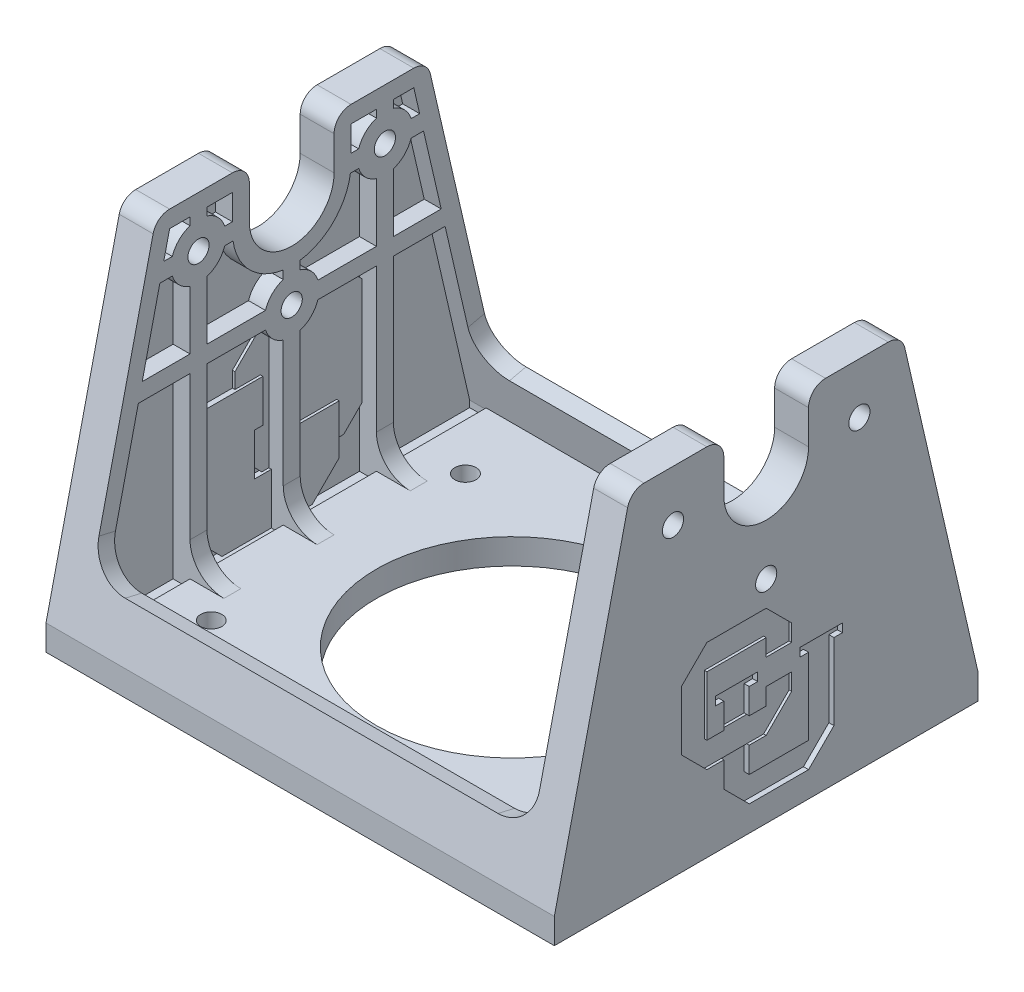
from build123d import *

# Parameters (mm, degrees)
SKETCH2_W           = 52
SKETCH2_H           = 50
BOSS_EXTRUDE2_DEPTH = 3
BOSS_EXTRUDE3_DEPTH = 4
CUT_EXTRUDE1_REACH  = 76.33
SKETCH4_R           = 1.25
SKETCH5_W           = 52
SKETCH5_H           = 6
BOSS_EXTRUDE4_DEPTH = 2
CUT_EXTRUDE2_REACH  = 57.191
SKETCH7_R           = 16
CUT_EXTRUDE3_REACH  = 57.191
SKETCH8_R           = 1.25
FILLET2_R           = 2
CUT_EXTRUDE4_DEPTH  = 0.3
CUT_EXTRUDE5_DEPTH  = 0.6
CIRPATTERN2_COUNT   = 2
SHELL2_START        = -27.7
SHELL2_OUTLINE_R    = 3.25
SHELL2_DEPTH        = 1.7
SHELL2_START_2      = 26
SHELL2_2_OUTLINE_R  = 3.25
SHELL2_2_DEPTH      = 1.7
SHELL2_START_3      = -27.4
SHELL2_3_DEPTH      = 1.4
SHELL2_4_DEPTH      = 1.4
SHELL2_START_4      = -28
SHELL2_5_OUTLINE_R  = 3.25
SHELL2_5_DEPTH      = 0.3
SHELL2_START_5      = 27.7
SHELL2_6_OUTLINE_R  = 3.25
SHELL2_6_DEPTH      = 0.3
BOSS_EXTRUDE7_REACH = 76.33
FILLET3_R           = 4
FILLET4_R           = 4


# Read off the part's stored shape, not the designer's step: Shell2
with BuildPart() as part:
    # Sketch2 → Boss-Extrude2 (new body)
    with BuildSketch(Plane(origin=(0, 0, 0), x_dir=(1, 0, 0), z_dir=(0, 1, 0))):
        Rectangle(SKETCH2_W, SKETCH2_H)
    extrude(amount=BOSS_EXTRUDE2_DEPTH)

    # Sketch3 → Boss-Extrude3 (add)
    with BuildSketch(Plane(origin=(26, 0, 0), x_dir=(0, 0, -1), z_dir=(1, 0, 0))):
        with BuildLine():
            Line((-25, 0), (25, 0))
            Line((25, 0), (25, 3))
            Line((25, 3), (16, 42))
            Line((16, 42), (5, 42))
            Line((5, 42), (5, 36))
            ThreePointArc((5, 36), (0, 31), (-5, 36))
            Line((-5, 36), (-5, 42))
            Line((-5, 42), (-16, 42))
            Line((-16, 42), (-25, 3))
            Line((-25, 3), (-25, 0))
        make_face()
    boss_extrude3 = extrude(amount=BOSS_EXTRUDE3_DEPTH)

    # Sketch4 → Cut-Extrude1 (cut, up to next)
    with BuildSketch(Plane(origin=(30, 0, 0), x_dir=(0, 0, -1), z_dir=(1, 0, 0)), mode=Mode.PRIVATE) as cut_extrude1_sk1:
        with Locations((11, 36)):
            Circle(SKETCH4_R)
    cut_extrude1_tool1 = extrude(cut_extrude1_sk1.sketch, amount=-CUT_EXTRUDE1_REACH, mode=Mode.PRIVATE) & part.part
    # Sketch4 → Cut-Extrude1 (cut, up to next)
    with BuildSketch(Plane(origin=(30, 0, 0), x_dir=(0, 0, -1), z_dir=(1, 0, 0)), mode=Mode.PRIVATE) as cut_extrude1_sk2:
        with Locations((0, 25)):
            Circle(SKETCH4_R)
    cut_extrude1_tool2 = extrude(cut_extrude1_sk2.sketch, amount=-CUT_EXTRUDE1_REACH, mode=Mode.PRIVATE) & part.part
    # Sketch4 → Cut-Extrude1 (cut, up to next)
    with BuildSketch(Plane(origin=(30, 0, 0), x_dir=(0, 0, -1), z_dir=(1, 0, 0)), mode=Mode.PRIVATE) as cut_extrude1_sk3:
        with Locations((-11, 36)):
            Circle(SKETCH4_R)
    cut_extrude1_tool3 = extrude(cut_extrude1_sk3.sketch, amount=-CUT_EXTRUDE1_REACH, mode=Mode.PRIVATE) & part.part
    cut_extrude1_1 = cut_extrude1_tool1.solids().sort_by_distance((30, 36, -11))[0]
    add(cut_extrude1_1, mode=Mode.SUBTRACT)
    cut_extrude1_2 = cut_extrude1_tool2.solids().sort_by_distance((30, 25, 0))[0]
    add(cut_extrude1_2, mode=Mode.SUBTRACT)
    cut_extrude1_3 = cut_extrude1_tool3.solids().sort_by_distance((30, 36, 11))[0]
    add(cut_extrude1_3, mode=Mode.SUBTRACT)
    cut_extrude1 = cut_extrude1_1 + cut_extrude1_2 + cut_extrude1_3  # Cut-Extrude1 as one shape, for the pattern or mirror that repeats it

    # Mirror1: Boss-Extrude3, Cut-Extrude1 across plane
    add(boss_extrude3.mirror(Plane(origin=(0, 0, 0), x_dir=(0, 0, 1), z_dir=(1, 0, 0))))
    add(cut_extrude1.mirror(Plane(origin=(0, 0, 0), x_dir=(0, 0, 1), z_dir=(1, 0, 0))), mode=Mode.SUBTRACT)

    # Sketch5 → Boss-Extrude4 (add)
    with BuildSketch(Plane(origin=(0, 5.629213483, -24.393258427), x_dir=(-1, 0, 0), z_dir=(0, 0.22485950669875854, -0.97439119569462))):
        with Locations((0, 0.30168592)):
            Rectangle(SKETCH5_W, SKETCH5_H)
    boss_extrude4 = extrude(amount=-BOSS_EXTRUDE4_DEPTH)

    # Mirror2: Boss-Extrude4 across plane
    add(boss_extrude4.mirror(Plane.XY))

    # Sketch7 → Cut-Extrude2 (cut, up to next)
    with BuildSketch(Plane(origin=(0, 3, 0), x_dir=(-1, 0, 0), z_dir=(0, 1, 0)), mode=Mode.PRIVATE) as cut_extrude2_sk1:
        with Locations(Location((0, 0, 0), (0, 0, 90))):
            Circle(SKETCH7_R)
    cut_extrude2_tool1 = extrude(cut_extrude2_sk1.sketch, amount=-CUT_EXTRUDE2_REACH, mode=Mode.PRIVATE) & part.part
    add(cut_extrude2_tool1.solids().sort_by_distance((0, 3, 0))[0], mode=Mode.SUBTRACT)

    # Sketch8 → Cut-Extrude3 (cut, up to next)
    with BuildSketch(Plane(origin=(0, 3, 0), x_dir=(1, 0, 0), z_dir=(0, 1, 0)), mode=Mode.PRIVATE) as cut_extrude3_sk1:
        with Locations(Location((20.5, 15.0030003, 0), (0, 0, 270))):
            Circle(SKETCH8_R)
    cut_extrude3_tool1 = extrude(cut_extrude3_sk1.sketch, amount=-CUT_EXTRUDE3_REACH, mode=Mode.PRIVATE) & part.part
    # Sketch8 → Cut-Extrude3 (cut, up to next)
    with BuildSketch(Plane(origin=(0, 3, 0), x_dir=(1, 0, 0), z_dir=(0, 1, 0)), mode=Mode.PRIVATE) as cut_extrude3_sk2:
        with Locations(Location((-20.5, 15.0030003, 0), (0, 0, 270))):
            Circle(SKETCH8_R)
    cut_extrude3_tool2 = extrude(cut_extrude3_sk2.sketch, amount=-CUT_EXTRUDE3_REACH, mode=Mode.PRIVATE) & part.part
    # Sketch8 → Cut-Extrude3 (cut, up to next)
    with BuildSketch(Plane(origin=(0, 3, 0), x_dir=(1, 0, 0), z_dir=(0, 1, 0)), mode=Mode.PRIVATE) as cut_extrude3_sk3:
        with Locations(Location((-20.5, -14.9969997, 0), (0, 0, 270))):
            Circle(SKETCH8_R)
    cut_extrude3_tool3 = extrude(cut_extrude3_sk3.sketch, amount=-CUT_EXTRUDE3_REACH, mode=Mode.PRIVATE) & part.part
    # Sketch8 → Cut-Extrude3 (cut, up to next)
    with BuildSketch(Plane(origin=(0, 3, 0), x_dir=(1, 0, 0), z_dir=(0, 1, 0)), mode=Mode.PRIVATE) as cut_extrude3_sk4:
        with Locations(Location((20.5, -14.9969997, 0), (0, 0, 270))):
            Circle(SKETCH8_R)
    cut_extrude3_tool4 = extrude(cut_extrude3_sk4.sketch, amount=-CUT_EXTRUDE3_REACH, mode=Mode.PRIVATE) & part.part
    add(cut_extrude3_tool1.solids().sort_by_distance((20.5, 3, -15.003))[0], mode=Mode.SUBTRACT)
    add(cut_extrude3_tool2.solids().sort_by_distance((-20.5, 3, -15.003))[0], mode=Mode.SUBTRACT)
    add(cut_extrude3_tool3.solids().sort_by_distance((-20.5, 3, 14.997))[0], mode=Mode.SUBTRACT)
    add(cut_extrude3_tool4.solids().sort_by_distance((20.5, 3, 14.997))[0], mode=Mode.SUBTRACT)

    # Fillet2
    fillet2_edges = [part.edges().sort_by_distance(p)[0] for p in [
        (28, 42, -16),
        (28, 42, -5),
        (28, 42, 5),
        (28, 42, 16),
        (-28, 42, 16),
        (-28, 42, 5),
        (-28, 42, -5),
        (-28, 42, -16),
    ]]
    fillet(fillet2_edges, radius=FILLET2_R)

    # Sketch15 → Cut-Extrude4 (cut)
    with BuildSketch(Plane(origin=(30, 0, 0), x_dir=(0, 0, -1), z_dir=(1, 0, 0))):
        Polygon((-7, 22), (0, 22), (3, 19), (3, 17), (0, 17), (0, 19), (-7, 19), (-7, 12), (0, 12), (0, 14), (3, 14), (3, 12), (0, 9), (-7, 9), (-10, 12), (-10, 19), align=None)
    cut_extrude4 = extrude(amount=-CUT_EXTRUDE4_DEPTH, mode=Mode.SUBTRACT)

    # Sketch16 → Cut-Extrude5 (cut)
    with BuildSketch(Plane(origin=(30, 0, 0), x_dir=(0, 0, -1), z_dir=(1, 0, 0))):
        Polygon((-2, 12), (-2, 15), (-1, 15), (-1, 16), (-6, 16), (-6, 15), (-5, 15), (-5, 12), align=None)
        Polygon((-5, 9), (-5, 6), (-2, 3), (5, 3), (8, 6), (8, 15), (9, 15), (9, 16), (4, 16), (4, 15), (5, 15), (5, 6), (-2, 6), (-2, 9), align=None)
    cut_extrude5 = extrude(amount=-CUT_EXTRUDE5_DEPTH, mode=Mode.SUBTRACT)

    # CirPattern2: Cut-Extrude4, Cut-Extrude5 ×2 about axis
    cirpattern2_axis = Axis((0, 0, 0), (0, 1, 0))
    add([cut_extrude4.rotate(cirpattern2_axis, i * 360 / CIRPATTERN2_COUNT) for i in range(1, CIRPATTERN2_COUNT)], mode=Mode.SUBTRACT)
    add([cut_extrude5.rotate(cirpattern2_axis, i * 360 / CIRPATTERN2_COUNT) for i in range(1, CIRPATTERN2_COUNT)], mode=Mode.SUBTRACT)

    # Shell2 outline → Shell2 (cut)
    with BuildSketch(Plane.YZ.offset(SHELL2_START)):
        with BuildLine():
            Line((11, 0), (11, -7))
            Line((11, -7), (5.171572875, -7))
            Line((5.171572875, -7), (2, -3.828427125))
            Line((2, -3.828427125), (2, -23))
            Line((2, -23), (2.772223957, -23))
            Line((2.772223957, -23), (3, -22.947436298))
            Line((3, -22.947436298), (8.396628161, -21.702060568))
            Line((8.396628161, -21.702060568), (40, -14.408974759))
            Line((40, -14.408974759), (40, -7))
            Line((40, -7), (36, -7))
            ThreePointArc((36, -7), (29, 0), (36, 7))
            Line((36, 7), (40, 7))
            Line((40, 7), (40, 14.408974759))
            Line((40, 14.408974759), (8.396628161, 21.702060568))
            Line((8.396628161, 21.702060568), (3, 22.947436298))
            Line((3, 22.947436298), (2.772223957, 23))
            Line((2.772223957, 23), (2, 23))
            Line((2, 23), (2, 6.828427125))
            Line((2, 6.828427125), (5.171572875, 10))
            Line((5.171572875, 10), (13, 10))
            Line((13, 10), (13, 11))
            Line((13, 11), (18, 11))
            Line((18, 11), (18, 2))
            Line((18, 2), (13, 2))
            Line((13, 2), (13, 3))
            Line((13, 3), (8, 3))
            Line((8, 3), (8, 0))
            Line((8, 0), (11, 0))
        make_face()
        with Locations((25, 0)):
            Circle(SHELL2_OUTLINE_R, mode=Mode.SUBTRACT)
        with Locations((36, -11)):
            Circle(SHELL2_OUTLINE_R, mode=Mode.SUBTRACT)
        with Locations((36, 11)):
            Circle(SHELL2_OUTLINE_R, mode=Mode.SUBTRACT)
    extrude(amount=SHELL2_DEPTH, mode=Mode.SUBTRACT)

    # Shell2 2 outline → Shell2 2 (cut)
    with BuildSketch(Plane.YZ.offset(SHELL2_START_2)):
        with BuildLine():
            Line((8, 0), (8, -3))
            Line((8, -3), (13, -3))
            Line((13, -3), (13, -2))
            Line((13, -2), (18, -2))
            Line((18, -2), (18, -11))
            Line((18, -11), (13, -11))
            Line((13, -11), (13, -10))
            Line((13, -10), (5.171572875, -10))
            Line((5.171572875, -10), (2, -6.828427125))
            Line((2, -6.828427125), (2, -23))
            Line((2, -23), (2.772223957, -23))
            Line((2.772223957, -23), (3, -22.947436298))
            Line((3, -22.947436298), (8.396628161, -21.702060568))
            Line((8.396628161, -21.702060568), (40, -14.408974759))
            Line((40, -14.408974759), (40, -7))
            Line((40, -7), (36, -7))
            ThreePointArc((36, -7), (29, 0), (36, 7))
            Line((36, 7), (40, 7))
            Line((40, 7), (40, 14.408974759))
            Line((40, 14.408974759), (8.396628161, 21.702060568))
            Line((8.396628161, 21.702060568), (3, 22.947436298))
            Line((3, 22.947436298), (2.772223957, 23))
            Line((2.772223957, 23), (2, 23))
            Line((2, 23), (2, 3.828427125))
            Line((2, 3.828427125), (5.171572875, 7))
            Line((5.171572875, 7), (11, 7))
            Line((11, 7), (11, 0))
            Line((11, 0), (8, 0))
        make_face()
        with Locations((25, 0)):
            Circle(SHELL2_2_OUTLINE_R, mode=Mode.SUBTRACT)
        with Locations((36, -11)):
            Circle(SHELL2_2_OUTLINE_R, mode=Mode.SUBTRACT)
        with Locations((36, 11)):
            Circle(SHELL2_2_OUTLINE_R, mode=Mode.SUBTRACT)
    extrude(amount=SHELL2_2_DEPTH, mode=Mode.SUBTRACT)

    # Shell2 3 outline → Shell2 3 (cut)
    with BuildSketch(Plane.YZ.offset(SHELL2_START_3)):
        Polygon((11, -7), (11, 0), (8, 0), (8, 3), (13, 3), (13, 2), (18, 2), (18, 11), (13, 11), (13, 10), (5.171572875, 10), (2, 6.828427125), (2, -3.828427125), (5.171572875, -7), align=None)
    extrude(amount=SHELL2_3_DEPTH, mode=Mode.SUBTRACT)

    # Shell2 4 outline → Shell2 4 (cut)
    with BuildSketch(Plane.YZ.offset(SHELL2_START_2)):
        Polygon((8, -3), (8, 0), (11, 0), (11, 7), (5.171572875, 7), (2, 3.828427125), (2, -6.828427125), (5.171572875, -10), (13, -10), (13, -11), (18, -11), (18, -2), (13, -2), (13, -3), align=None)
    extrude(amount=SHELL2_4_DEPTH, mode=Mode.SUBTRACT)

    # Shell2 5 outline → Shell2 5 (cut)
    # profile 1 of 2: a face of its own
    with BuildSketch(Plane.YZ.offset(SHELL2_START_4)):
        with BuildLine():
            Line((7, -7.828427125), (7, -7))
            Line((7, -7), (5.171572875, -7))
            Line((5.171572875, -7), (2, -3.828427125))
            Line((2, -3.828427125), (2, -23))
            Line((2, -23), (2.772223957, -23))
            Line((2.772223957, -23), (3, -22.947436298))
            Line((3, -22.947436298), (8.396628161, -21.702060568))
            Line((8.396628161, -21.702060568), (40, -14.408974759))
            Line((40, -14.408974759), (40, -7))
            Line((40, -7), (36, -7))
            ThreePointArc((36, -7), (29, 0), (36, 7))
            Line((36, 7), (40, 7))
            Line((40, 7), (40, 14.408974759))
            Line((40, 14.408974759), (8.396628161, 21.702060568))
            Line((8.396628161, 21.702060568), (3, 22.947436298))
            Line((3, 22.947436298), (2.772223957, 23))
            Line((2.772223957, 23), (2, 23))
            Line((2, 23), (2, 6.828427125))
            Line((2, 6.828427125), (5.171572875, 10))
            Line((5.171572875, 10), (13, 10))
            Line((13, 10), (13, 11))
            Line((13, 11), (18, 11))
            Line((18, 11), (18, 5))
            Line((18, 5), (19.828427125, 5))
            Line((19.828427125, 5), (22.617718257, 2.210708868))
            ThreePointArc((22.617718257, 2.210708868), (28.144918232, 0.819749544), (24, -3.092329219))
            Line((24, -3.092329219), (24, -7.828427125))
            Line((24, -7.828427125), (19.828427125, -12))
            Line((19.828427125, -12), (11.171572875, -12))
            Line((11.171572875, -12), (7, -7.828427125))
        make_face()
        with Locations((36, -11)):
            Circle(SHELL2_5_OUTLINE_R, mode=Mode.SUBTRACT)
        with Locations((36, 11)):
            Circle(SHELL2_5_OUTLINE_R, mode=Mode.SUBTRACT)
    # profile 2 of 2: a face of its own
    with BuildSketch(Plane.YZ.offset(SHELL2_START_4)):
        Polygon((8, 3), (8, 1.828427125), (9.171572875, 3), align=None)
    extrude(amount=SHELL2_5_DEPTH, mode=Mode.SUBTRACT)

    # Shell2 6 outline → Shell2 6 (cut)
    # profile 1 of 2: a face of its own
    with BuildSketch(Plane.YZ.offset(SHELL2_START_5)):
        Polygon((8, -3), (9.171572875, -3), (8, -1.828427125), align=None)
    # profile 2 of 2: a face of its own
    with BuildSketch(Plane.YZ.offset(SHELL2_START_5)):
        with BuildLine():
            Line((19.828427125, -5), (18, -5))
            Line((18, -5), (18, -11))
            Line((18, -11), (13, -11))
            Line((13, -11), (13, -10))
            Line((13, -10), (5.171572875, -10))
            Line((5.171572875, -10), (2, -6.828427125))
            Line((2, -6.828427125), (2, -23))
            Line((2, -23), (2.772223957, -23))
            Line((2.772223957, -23), (3, -22.947436298))
            Line((3, -22.947436298), (8.396628161, -21.702060568))
            Line((8.396628161, -21.702060568), (40, -14.408974759))
            Line((40, -14.408974759), (40, -7))
            Line((40, -7), (36, -7))
            ThreePointArc((36, -7), (29, 0), (36, 7))
            Line((36, 7), (40, 7))
            Line((40, 7), (40, 14.408974759))
            Line((40, 14.408974759), (8.396628161, 21.702060568))
            Line((8.396628161, 21.702060568), (3, 22.947436298))
            Line((3, 22.947436298), (2.772223957, 23))
            Line((2.772223957, 23), (2, 23))
            Line((2, 23), (2, 3.828427125))
            Line((2, 3.828427125), (5.171572875, 7))
            Line((5.171572875, 7), (7, 7))
            Line((7, 7), (7, 7.828427125))
            Line((7, 7.828427125), (11.171572875, 12))
            Line((11.171572875, 12), (19.828427125, 12))
            Line((19.828427125, 12), (24, 7.828427125))
            Line((24, 7.828427125), (24, 3.092329219))
            ThreePointArc((24, 3.092329219), (28.144918232, -0.819749544), (22.617718257, -2.210708868))
            Line((22.617718257, -2.210708868), (19.828427125, -5))
        make_face()
        with Locations((36, -11)):
            Circle(SHELL2_6_OUTLINE_R, mode=Mode.SUBTRACT)
        with Locations((36, 11)):
            Circle(SHELL2_6_OUTLINE_R, mode=Mode.SUBTRACT)
    extrude(amount=SHELL2_6_DEPTH, mode=Mode.SUBTRACT)

    # Sketch12 → Boss-Extrude7 (add, up to next)
    with BuildSketch(Plane.ZY.offset(-26), mode=Mode.PRIVATE) as boss_extrude7_sk1:
        with BuildLine():
            Line((-1, 0), (1, 0))
            Line((1, 0), (1, 21.907670781))
            ThreePointArc((1, 21.907670781), (0, 21.75), (-1, 21.907670781))
            Line((-1, 21.907670781), (-1, 0))
        make_face()
    boss_extrude7_tool1 = extrude(boss_extrude7_sk1.sketch, amount=-BOSS_EXTRUDE7_REACH, mode=Mode.PRIVATE) - part.part
    # Sketch12 → Boss-Extrude7 (add, up to next)
    with BuildSketch(Plane.ZY.offset(-26), mode=Mode.PRIVATE) as boss_extrude7_sk2:
        with BuildLine():
            Line((1, 28.092329219), (1, 31.101020514))
            ThreePointArc((1, 31.101020514), (0, 31), (-1, 31.101020514))
            Line((-1, 31.101020514), (-1, 28.092329219))
            ThreePointArc((-1, 28.092329219), (0, 28.25), (1, 28.092329219))
        make_face()
    boss_extrude7_tool2 = extrude(boss_extrude7_sk2.sketch, amount=-BOSS_EXTRUDE7_REACH, mode=Mode.PRIVATE) - part.part
    # Sketch12 → Boss-Extrude7 (add, up to next)
    with BuildSketch(Plane.ZY.offset(-26), mode=Mode.PRIVATE) as boss_extrude7_sk3:
        with BuildLine():
            Line((-12, 0), (-10, 0))
            Line((-10, 0), (-10, 23.987088745))
            Line((-10, 23.987088745), (-3.088124154, 23.987088745))
            ThreePointArc((-3.088124154, 23.987088745), (-3.249971672, 24.986430417), (-3.096474739, 25.987088745))
            Line((-3.096474739, 25.987088745), (-10, 25.987088745))
            Line((-10, 25.987088745), (-10, 32.907670781))
            ThreePointArc((-10, 32.907670781), (-11, 32.75), (-12, 32.907670781))
            Line((-12, 32.907670781), (-12, 25.987088745))
            Line((-12, 25.987088745), (-17.642723511, 25.987088745))
            Line((-17.642723511, 25.987088745), (-18.104261972, 23.987088745))
            Line((-18.104261972, 23.987088745), (-12, 23.987088745))
            Line((-12, 23.987088745), (-12, 0))
        make_face()
    boss_extrude7_tool3 = extrude(boss_extrude7_sk3.sketch, amount=-BOSS_EXTRUDE7_REACH, mode=Mode.PRIVATE) - part.part
    # Sketch12 → Boss-Extrude7 (add, up to next)
    with BuildSketch(Plane.ZY.offset(-26), mode=Mode.PRIVATE) as boss_extrude7_sk4:
        with BuildLine():
            Line((-12, 40), (-10, 40))
            Line((-10, 40), (-10, 39.092329219))
            ThreePointArc((-10, 39.092329219), (-11, 39.25), (-12, 39.092329219))
            Line((-12, 39.092329219), (-12, 40))
        make_face()
    boss_extrude7_tool4 = extrude(boss_extrude7_sk4.sketch, amount=-BOSS_EXTRUDE7_REACH, mode=Mode.PRIVATE) - part.part
    # Sketch12 → Boss-Extrude7 (add, up to next)
    with BuildSketch(Plane.ZY.offset(-26), mode=Mode.PRIVATE) as boss_extrude7_sk5:
        with BuildLine():
            Line((10, 39.092329219), (10, 40))
            Line((10, 40), (12, 40))
            Line((12, 40), (12, 39.092329219))
            ThreePointArc((12, 39.092329219), (11, 39.25), (10, 39.092329219))
        make_face()
    boss_extrude7_tool5 = extrude(boss_extrude7_sk5.sketch, amount=-BOSS_EXTRUDE7_REACH, mode=Mode.PRIVATE) - part.part
    # Sketch12 → Boss-Extrude7 (add, up to next)
    with BuildSketch(Plane.ZY.offset(-26), mode=Mode.PRIVATE) as boss_extrude7_sk6:
        with BuildLine():
            Line((10, 0), (10, 23.987088745))
            Line((10, 23.987088745), (3.088124154, 23.987088745))
            ThreePointArc((3.088124154, 23.987088745), (3.249971672, 24.986430417), (3.096474739, 25.987088745))
            Line((3.096474739, 25.987088745), (10, 25.987088745))
            Line((10, 25.987088745), (10, 32.907670781))
            ThreePointArc((10, 32.907670781), (11, 32.75), (12, 32.907670781))
            Line((12, 32.907670781), (12, 25.987088745))
            Line((12, 25.987088745), (17.642723511, 25.987088745))
            Line((17.642723511, 25.987088745), (18.104261972, 23.987088745))
            Line((18.104261972, 23.987088745), (12, 23.987088745))
            Line((12, 23.987088745), (12, 0))
            Line((12, 0), (10, 0))
        make_face()
    boss_extrude7_tool6 = extrude(boss_extrude7_sk6.sketch, amount=-BOSS_EXTRUDE7_REACH, mode=Mode.PRIVATE) - part.part
    # Sketch12 → Boss-Extrude7 (add, up to next)
    with BuildSketch(Plane.ZY.offset(-26), mode=Mode.PRIVATE) as boss_extrude7_sk7:
        with BuildLine():
            Line((-15.101282452, 37), (-14.092329219, 37))
            ThreePointArc((-14.092329219, 37), (-14.25, 36), (-14.092329219, 35))
            Line((-14.092329219, 35), (-15.562820913, 35))
            Line((-15.562820913, 35), (-15.101282452, 37))
        make_face()
    boss_extrude7_tool7 = extrude(boss_extrude7_sk7.sketch, amount=-BOSS_EXTRUDE7_REACH, mode=Mode.PRIVATE) - part.part
    # Sketch12 → Boss-Extrude7 (add, up to next)
    with BuildSketch(Plane.ZY.offset(-26), mode=Mode.PRIVATE) as boss_extrude7_sk8:
        with BuildLine():
            Line((-7.907670781, 37), (-7, 37))
            Line((-7, 37), (-7, 36))
            ThreePointArc((-7, 36), (-6.982027736, 35.498712962), (-6.92820323, 35))
            Line((-6.92820323, 35), (-7.907670781, 35))
            ThreePointArc((-7.907670781, 35), (-7.75, 36), (-7.907670781, 37))
        make_face()
    boss_extrude7_tool8 = extrude(boss_extrude7_sk8.sketch, amount=-BOSS_EXTRUDE7_REACH, mode=Mode.PRIVATE) - part.part
    # Sketch12 → Boss-Extrude7 (add, up to next)
    with BuildSketch(Plane.ZY.offset(-26), mode=Mode.PRIVATE) as boss_extrude7_sk9:
        with BuildLine():
            Line((7, 37), (7, 36))
            ThreePointArc((7, 36), (6.982027736, 35.498712962), (6.92820323, 35))
            Line((6.92820323, 35), (7.907670781, 35))
            ThreePointArc((7.907670781, 35), (7.75, 36), (7.907670781, 37))
            Line((7.907670781, 37), (7, 37))
        make_face()
    boss_extrude7_tool9 = extrude(boss_extrude7_sk9.sketch, amount=-BOSS_EXTRUDE7_REACH, mode=Mode.PRIVATE) - part.part
    # Sketch12 → Boss-Extrude7 (add, up to next)
    with BuildSketch(Plane.ZY.offset(-26), mode=Mode.PRIVATE) as boss_extrude7_sk10:
        with BuildLine():
            Line((15.101282452, 37), (15.562820913, 35))
            Line((15.562820913, 35), (14.092329219, 35))
            ThreePointArc((14.092329219, 35), (14.25, 36), (14.092329219, 37))
            Line((14.092329219, 37), (15.101282452, 37))
        make_face()
    boss_extrude7_tool10 = extrude(boss_extrude7_sk10.sketch, amount=-BOSS_EXTRUDE7_REACH, mode=Mode.PRIVATE) - part.part
    boss_extrude7_1 = boss_extrude7_tool1.solids().sort_by_distance((26, 10.901068, 0))[0]
    add(boss_extrude7_1)
    boss_extrude7_2 = boss_extrude7_tool2.solids().sort_by_distance((26, 29.615523, 0))[0]
    add(boss_extrude7_2)
    boss_extrude7_3 = boss_extrude7_tool3.solids().sort_by_distance((26, 18.792438, -10.850347))[0]
    add(boss_extrude7_3)
    boss_extrude7_4 = boss_extrude7_tool4.solids().sort_by_distance((26, 39.597614, -11))[0]
    add(boss_extrude7_4)
    boss_extrude7_5 = boss_extrude7_tool5.solids().sort_by_distance((26, 39.597614, 11))[0]
    add(boss_extrude7_5)
    boss_extrude7_6 = boss_extrude7_tool6.solids().sort_by_distance((26, 18.792438, 10.850347))[0]
    add(boss_extrude7_6)
    boss_extrude7_7 = boss_extrude7_tool7.solids().sort_by_distance((26, 35.932172, -14.771867))[0]
    add(boss_extrude7_7)
    boss_extrude7_8 = boss_extrude7_tool8.solids().sort_by_distance((26, 35.988993, -7.396167))[0]
    add(boss_extrude7_8)
    boss_extrude7_9 = boss_extrude7_tool9.solids().sort_by_distance((26, 35.988993, 7.396167))[0]
    add(boss_extrude7_9)
    boss_extrude7_10 = boss_extrude7_tool10.solids().sort_by_distance((26, 35.932172, 14.771867))[0]
    add(boss_extrude7_10)
    boss_extrude7 = boss_extrude7_1 + boss_extrude7_2 + boss_extrude7_3 + boss_extrude7_4 + boss_extrude7_5 + boss_extrude7_6 + boss_extrude7_7 + boss_extrude7_8 + boss_extrude7_9 + boss_extrude7_10  # Boss-Extrude7 as one shape, for the pattern or mirror that repeats it

    # Mirror3: Boss-Extrude7 mirrored; each copy of Boss-Extrude7 runs up to whatever stops it at its own place
    mirror3_before = part.part  # the part as the pattern finds it: every copy runs up to it
    mirror3_boss_extrude7_long1 = extrude(boss_extrude7_sk1.sketch, amount=-BOSS_EXTRUDE7_REACH, mode=Mode.PRIVATE)
    mirror3_boss_extrude7_long2 = extrude(boss_extrude7_sk2.sketch, amount=-BOSS_EXTRUDE7_REACH, mode=Mode.PRIVATE)
    mirror3_boss_extrude7_long3 = extrude(boss_extrude7_sk3.sketch, amount=-BOSS_EXTRUDE7_REACH, mode=Mode.PRIVATE)
    mirror3_boss_extrude7_long4 = extrude(boss_extrude7_sk4.sketch, amount=-BOSS_EXTRUDE7_REACH, mode=Mode.PRIVATE)
    mirror3_boss_extrude7_long5 = extrude(boss_extrude7_sk5.sketch, amount=-BOSS_EXTRUDE7_REACH, mode=Mode.PRIVATE)
    mirror3_boss_extrude7_long6 = extrude(boss_extrude7_sk6.sketch, amount=-BOSS_EXTRUDE7_REACH, mode=Mode.PRIVATE)
    mirror3_boss_extrude7_long7 = extrude(boss_extrude7_sk7.sketch, amount=-BOSS_EXTRUDE7_REACH, mode=Mode.PRIVATE)
    mirror3_boss_extrude7_long8 = extrude(boss_extrude7_sk8.sketch, amount=-BOSS_EXTRUDE7_REACH, mode=Mode.PRIVATE)
    mirror3_boss_extrude7_long9 = extrude(boss_extrude7_sk9.sketch, amount=-BOSS_EXTRUDE7_REACH, mode=Mode.PRIVATE)
    mirror3_boss_extrude7_long10 = extrude(boss_extrude7_sk10.sketch, amount=-BOSS_EXTRUDE7_REACH, mode=Mode.PRIVATE)
    mirror3_boss_extrude7_tool1_1 = mirror3_boss_extrude7_long1.mirror(Plane(origin=(0, 0, 0), x_dir=(0, 0, 1), z_dir=(1, 0, 0))) - mirror3_before
    add(mirror3_boss_extrude7_tool1_1.solids().sort_by_distance((-26, 10.901068, 0))[0])
    mirror3_boss_extrude7_tool2_1 = mirror3_boss_extrude7_long2.mirror(Plane(origin=(0, 0, 0), x_dir=(0, 0, 1), z_dir=(1, 0, 0))) - mirror3_before
    add(mirror3_boss_extrude7_tool2_1.solids().sort_by_distance((-26, 29.615523, 0))[0])
    mirror3_boss_extrude7_tool3_1 = mirror3_boss_extrude7_long3.mirror(Plane(origin=(0, 0, 0), x_dir=(0, 0, 1), z_dir=(1, 0, 0))) - mirror3_before
    add(mirror3_boss_extrude7_tool3_1.solids().sort_by_distance((-26, 18.792438, -10.850347))[0])
    mirror3_boss_extrude7_tool4_1 = mirror3_boss_extrude7_long4.mirror(Plane(origin=(0, 0, 0), x_dir=(0, 0, 1), z_dir=(1, 0, 0))) - mirror3_before
    add(mirror3_boss_extrude7_tool4_1.solids().sort_by_distance((-26, 39.597614, -11))[0])
    mirror3_boss_extrude7_tool5_1 = mirror3_boss_extrude7_long5.mirror(Plane(origin=(0, 0, 0), x_dir=(0, 0, 1), z_dir=(1, 0, 0))) - mirror3_before
    add(mirror3_boss_extrude7_tool5_1.solids().sort_by_distance((-26, 39.597614, 11))[0])
    mirror3_boss_extrude7_tool6_1 = mirror3_boss_extrude7_long6.mirror(Plane(origin=(0, 0, 0), x_dir=(0, 0, 1), z_dir=(1, 0, 0))) - mirror3_before
    add(mirror3_boss_extrude7_tool6_1.solids().sort_by_distance((-26, 18.792438, 10.850347))[0])
    mirror3_boss_extrude7_tool7_1 = mirror3_boss_extrude7_long7.mirror(Plane(origin=(0, 0, 0), x_dir=(0, 0, 1), z_dir=(1, 0, 0))) - mirror3_before
    add(mirror3_boss_extrude7_tool7_1.solids().sort_by_distance((-26, 35.932172, -14.771867))[0])
    mirror3_boss_extrude7_tool8_1 = mirror3_boss_extrude7_long8.mirror(Plane(origin=(0, 0, 0), x_dir=(0, 0, 1), z_dir=(1, 0, 0))) - mirror3_before
    add(mirror3_boss_extrude7_tool8_1.solids().sort_by_distance((-26, 35.988993, -7.396167))[0])
    mirror3_boss_extrude7_tool9_1 = mirror3_boss_extrude7_long9.mirror(Plane(origin=(0, 0, 0), x_dir=(0, 0, 1), z_dir=(1, 0, 0))) - mirror3_before
    add(mirror3_boss_extrude7_tool9_1.solids().sort_by_distance((-26, 35.988993, 7.396167))[0])
    mirror3_boss_extrude7_tool10_1 = mirror3_boss_extrude7_long10.mirror(Plane(origin=(0, 0, 0), x_dir=(0, 0, 1), z_dir=(1, 0, 0))) - mirror3_before
    add(mirror3_boss_extrude7_tool10_1.solids().sort_by_distance((-26, 35.932172, 14.771867))[0])

    # Fillet3
    fillet3_edges = [part.edges().sort_by_distance(p)[0] for p in [
        (26, 3, 0),
        (26, 3, -11),
        (26, 3, 11),
        (-26, 3, 0),
        (-26, 3, -11),
        (-26, 3, 11),
    ]]
    fillet(fillet3_edges, radius=FILLET3_R)

    # Fillet4
    fillet4_edges = [part.edges().sort_by_distance(p)[0] for p in [
        (26, 8.621487667, 22.676451764),
        (-26, 8.621487667, 22.676451764),
        (-26, 8.621487667, -22.676451764),
        (26, 8.621487667, -22.676451764),
    ]]
    fillet(fillet4_edges, radius=FILLET4_R)


solid = part.part
